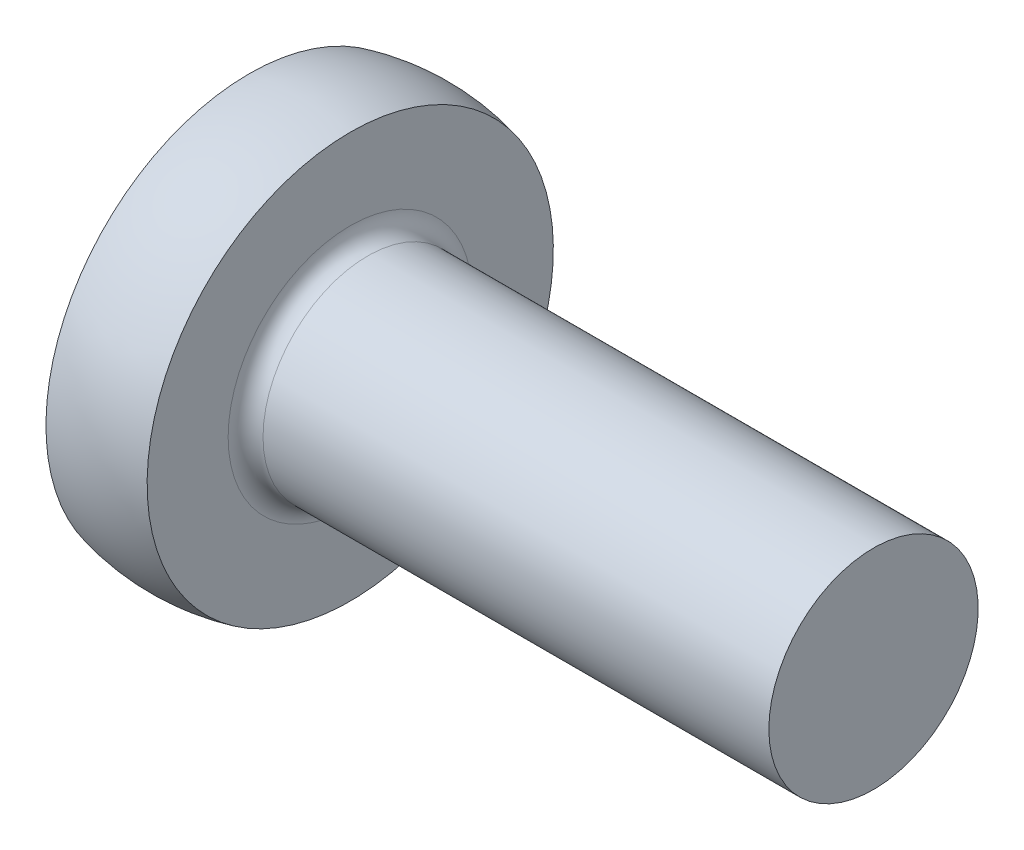
from build123d import *

# Parameters (mm, degrees)
FILLET1_R = 0.1


with BuildPart() as part:
    # Sketch1 → Base-Revolve (revolve)
    with BuildSketch(Plane.XY):
        with BuildLine():
            Line((0, 1.164431192), (0, 0))
            Line((0, 0), (3.58, 0))
            Line((3.58, 0), (3.58, 0.6))
            Line((3.58, 0.6), (0.58, 0.6))
            Line((0.58, 0.6), (0.58, 1.164431192))
            ThreePointArc((0.58, 1.164431192), (0.29, 1.2), (0, 1.164431192))
        make_face()
    revolve(axis=Axis((-2.318253968, 0, 0), (1, 0, 0)))

    # Fillet1
    fillet1_edges = [part.edges().sort_by_distance(p)[0] for p in [
        (0.58, -0.6, 0),
    ]]
    fillet(fillet1_edges, radius=FILLET1_R)


solid = part.part
